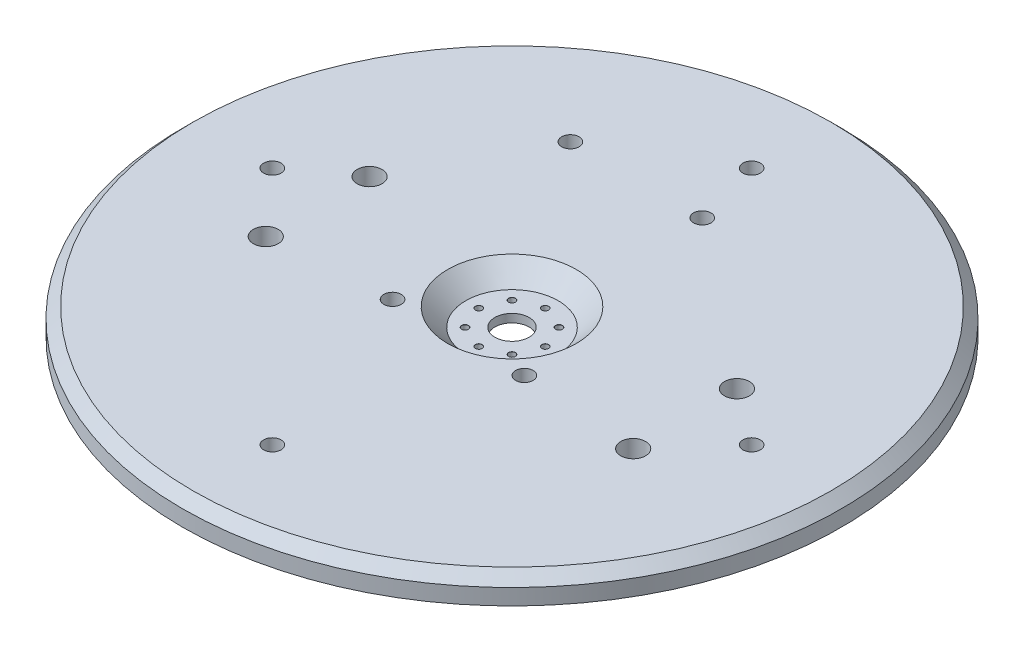
from build123d import *

# Parameters (mm, degrees)
SKETCH1_R                             = 79.375
BOSS_EXTRUDE1_DEPTH                   = 3.175
TAP_DRILL_FOR_M5X0_8_TAP1_D           = 4.2
TAP_DRILL_FOR_M7X1_0_TAP1_D           = 6
SKETCH32_R                            = 4.127000001
CUT_EXTRUDE1_DEPTH                    = 113.432663181
SKETCH32_4_R                          = 11.126999971
SKETCH32_4_R_2                        = 4.127000001
CUT_EXTRUDE2_DEPTH                    = 4.35
CHAMFER1_SIZE                         = 4.35
TAP_DRILL_FOR_M2X0_4_TAP1_D           = 1.6
TAP_DRILL_FOR_M2X0_4_TAP1_CSINK_D     = 1.65
TAP_DRILL_FOR_M2X0_4_TAP1_CSINK_ANGLE = 90
CHAMFER2_SIZE                         = 2.5
TAP_DRILL_FOR_M5X0_8_TAP2_D           = 4.2


with BuildPart() as part:
    # Sketch1 → Boss-Extrude1 (new, symmetric)
    with BuildSketch(Plane(origin=(0, 0, 0), x_dir=(1, 0, 0), z_dir=(0, 1, 0))):
        with Locations(Location((0, 0, 0), (0, 0, 270))):
            Circle(SKETCH1_R)
    extrude(amount=BOSS_EXTRUDE1_DEPTH, both=True)

    # Tap Drill for M5x0.8 Tap1 (through all)
    with Locations(Plane(origin=(0, 3.175, 0), x_dir=(1, 0, 0), z_dir=(0, 1, 0))):
        with Locations((-27.3188086, 41.38978387), (4.4311914, 41.38978387), (-15.875, -12.895910708), (15.875, -12.895910708)):
            Hole(TAP_DRILL_FOR_M5X0_8_TAP1_D / 2)

    # Tap Drill for M7x1.0 Tap1 (through all)
    with Locations(Plane(origin=(0, 3.175, 0), x_dir=(1, 0, 0), z_dir=(0, 1, 0))):
        with Locations((-44.245, 9.941583672), (-44.245, -15.058416328), (44.245, 9.941583672), (44.245, -15.058416328)):
            Hole(TAP_DRILL_FOR_M7X1_0_TAP1_D / 2)

    # Sketch32 → Cut-Extrude1 (cut, through all)
    with BuildSketch(Plane(origin=(0, 3.175, 0), x_dir=(1, 0, 0), z_dir=(0, 1, 0))):
        with Locations(Location((0, 0, 0), (0, 0, 270))):
            Circle(SKETCH32_R)
    extrude(amount=-CUT_EXTRUDE1_DEPTH, mode=Mode.SUBTRACT)

    # Sketch32<4> → Cut-Extrude2 (cut)
    with BuildSketch(Plane(origin=(0, 3.175, 0), x_dir=(1, 0, 0), z_dir=(0, 1, 0))):
        with Locations(Location((0, 0, 0), (0, 0, 270))):
            Circle(SKETCH32_4_R)
        with Locations(Location((0, 0, 0), (0, 0, 270))):
            Circle(SKETCH32_4_R_2, mode=Mode.SUBTRACT)
    extrude(amount=-CUT_EXTRUDE2_DEPTH, mode=Mode.SUBTRACT)

    # Chamfer1
    chamfer1_edges = [part.edges().sort_by_distance(p)[0] for p in [
        (0, 3.175, -11.126999971),
    ]]
    chamfer(chamfer1_edges, length=CHAMFER1_SIZE - 0.0001)  # a hair under: the kernel refuses the full size

    # Tap Drill for M2x0.4 Tap1 (through all)
    with Locations(Plane(origin=(0, -1.175, 0), x_dir=(1, 0, 0), z_dir=(0, 1, 0))):
        with Locations((-8, 0), (-5.656854249, 5.656854249), (0, 8), (5.656854249, 5.656854249), (8, 0), (5.656854249, -5.656854249), (0, -8), (-5.656854249, -5.656854249)):
            CounterSinkHole(TAP_DRILL_FOR_M2X0_4_TAP1_D / 2, TAP_DRILL_FOR_M2X0_4_TAP1_CSINK_D / 2, counter_sink_angle=TAP_DRILL_FOR_M2X0_4_TAP1_CSINK_ANGLE)

    # Chamfer2
    chamfer2_edges = [part.edges().sort_by_distance(p)[0] for p in [
        (0, 3.175, -79.375),
    ]]
    chamfer(chamfer2_edges, length=CHAMFER2_SIZE)

    # Tap Drill for M5x0.8 Tap2 (through all)
    with Locations(Plane(origin=(0, 3.175, 0), x_dir=(1, 0, 0), z_dir=(0, 1, 0))):
        with Locations((-57.723385101, 0), (0, 57.723385101), (57.723385101, 0), (0, -57.723385101)):
            Hole(TAP_DRILL_FOR_M5X0_8_TAP2_D / 2)


solid = part.part
